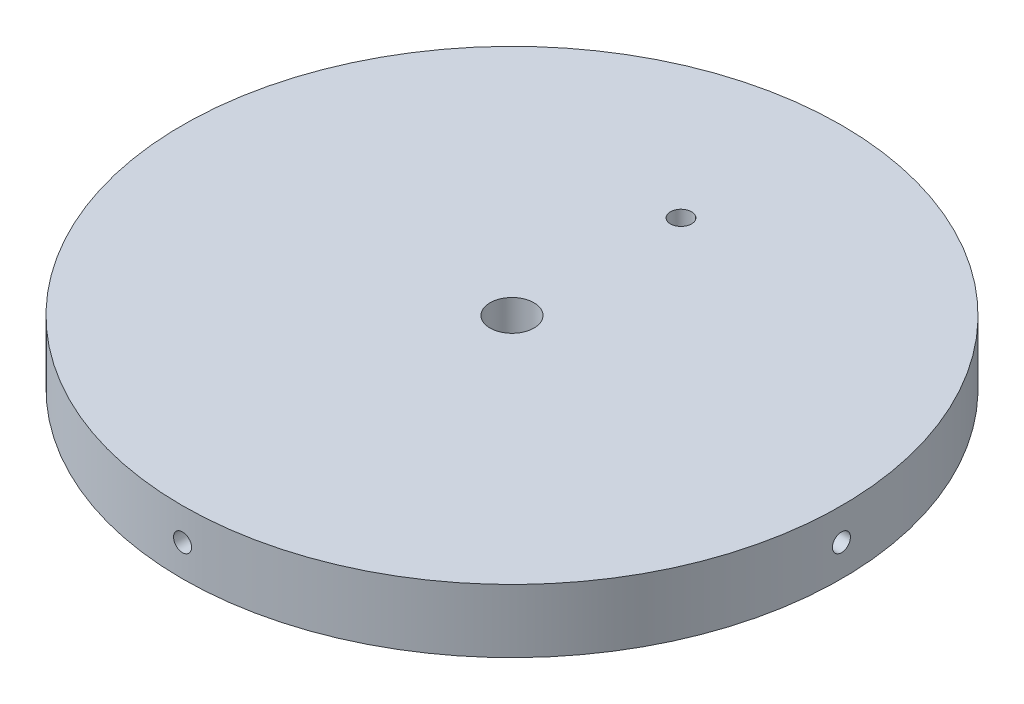
from build123d import *

# Parameters (mm, degrees)
SKETCH1_R           = 49.53
SKETCH1_R_2         = 3.3
SKETCH1_R_3         = 1.5875
BOSS_EXTRUDE1_DEPTH = 4.7625
SKETCH2_R           = 1.35255
CUT_EXTRUDE1_DEPTH  = 12.7
CIRPATTERN1_COUNT   = 4


with BuildPart() as part:
    # Sketch1 → Boss-Extrude1 (new, symmetric)
    with BuildSketch(Plane(origin=(0, 0, 0), x_dir=(1, 0, 0), z_dir=(0, 1, 0))):
        Circle(SKETCH1_R)
        Circle(SKETCH1_R_2, mode=Mode.SUBTRACT)
        with Locations((0, 25.4)):
            Circle(SKETCH1_R_3, mode=Mode.SUBTRACT)
    extrude(amount=BOSS_EXTRUDE1_DEPTH, both=True)

    # Sketch2 → Cut-Extrude1 (cut)
    with BuildSketch(Plane.XY.offset(50.8)):
        Circle(SKETCH2_R)
    cut_extrude1 = extrude(amount=-CUT_EXTRUDE1_DEPTH, mode=Mode.SUBTRACT)

    # CirPattern1: Cut-Extrude1 ×4 about axis
    cirpattern1_axis = Axis((0, 4.7625, 0), (0, -1, 0))
    for i in range(1, CIRPATTERN1_COUNT):
        add(cut_extrude1.rotate(cirpattern1_axis, i * 360 / CIRPATTERN1_COUNT), mode=Mode.SUBTRACT)


solid = part.part
